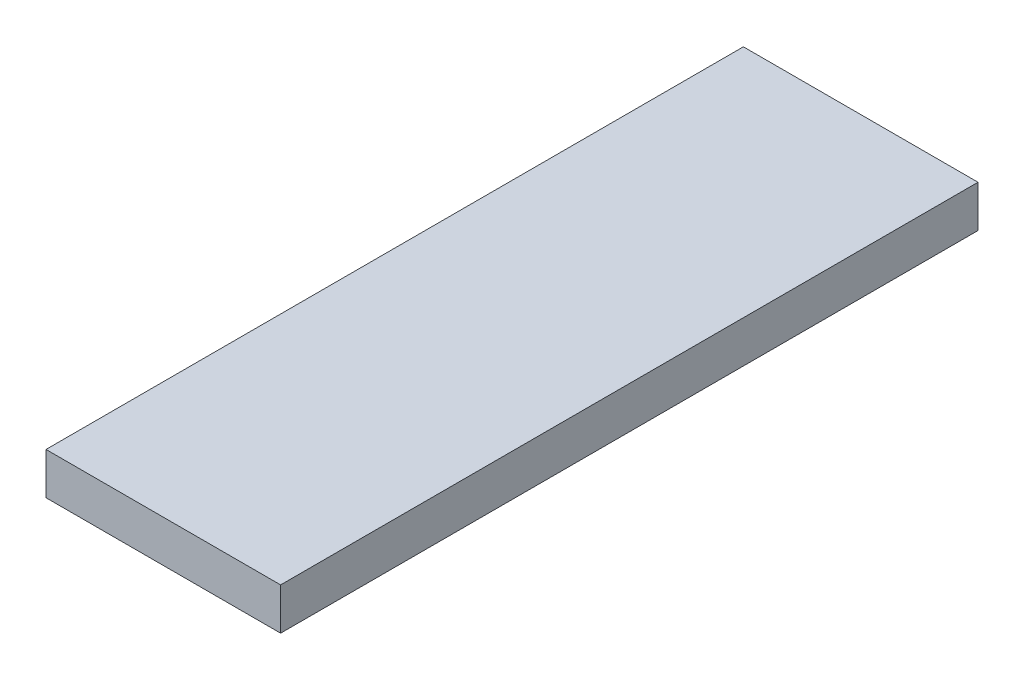
from build123d import *

# Parameters (mm, degrees)
SKETCH1_W           = 16.82
SKETCH1_H           = 50
BOSS_EXTRUDE1_DEPTH = 3


with BuildPart() as part:
    # Sketch1 → Boss-Extrude1 (new body)
    with BuildSketch(Plane(origin=(0, 0, 0), x_dir=(1, 0, 0), z_dir=(0, 1, 0))):
        with Locations((8.41, 25)):
            Rectangle(SKETCH1_W, SKETCH1_H)
    extrude(amount=BOSS_EXTRUDE1_DEPTH)


solid = part.part
